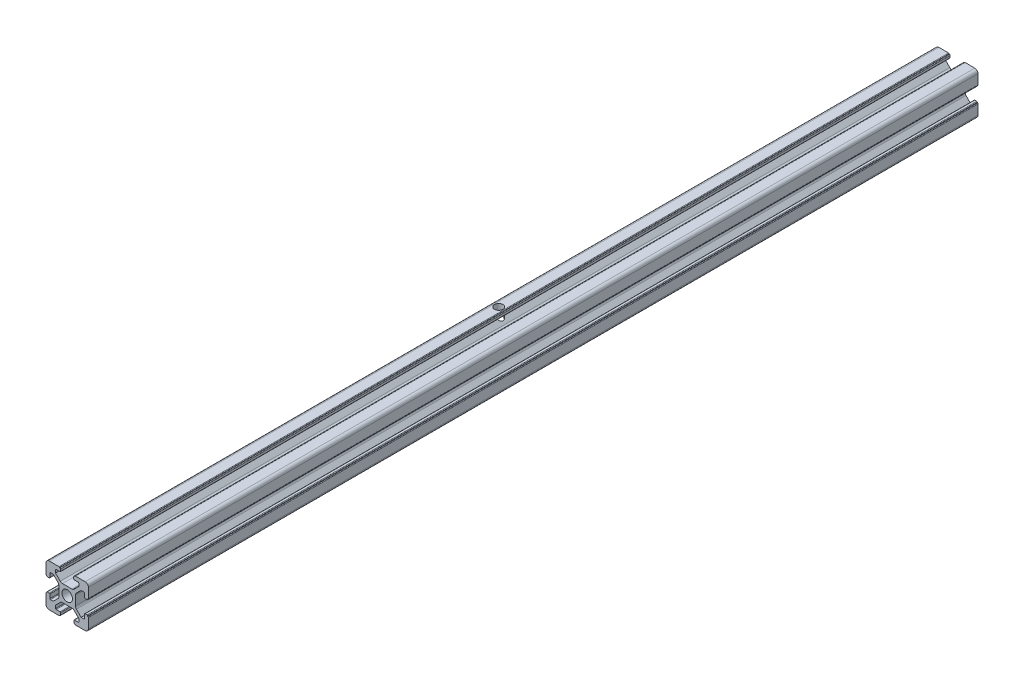
from build123d import *

# Parameters (mm, degrees)
BOSS_EXTRUDE1_DEPTH = 420
F_3DSKETCH2_R       = 2.5
CUT_EXTRUDE1_DEPTH  = 421.238108785
SKETCH2_R           = 2
CUT_EXTRUDE2_DEPTH  = 421.594909523


with BuildPart() as part:
    # Sketch1 → Boss-Extrude1 (new body)
    with BuildSketch(Plane.XY):
        with BuildLine():
            ThreePointArc((-4.339541497, 3.27832502), (-4.01438237, 2.791689997), (-3.900201668, 2.217664848))
            Line((-3.900201668, 2.217664848), (-3.900201668, -2.220777458))
            ThreePointArc((-3.900201668, -2.220777458), (-4.013982246, -2.793835668), (-4.338062619, -3.279956687))
            ThreePointArc((-4.338062619, -3.279956687), (-4.338801799, -3.280697416), (-4.339541497, -3.28143763))
            Line((-4.339541497, -3.28143763), (-6.559305445, -5.501201578))
            Line((-6.559305445, -5.501201578), (-7.918645273, -5.501201578))
            ThreePointArc((-7.918645273, -5.501201578), (-8.116635172, -5.419191476), (-8.198645273, -5.221201578))
            Line((-8.198645273, -5.221201578), (-8.198645273, -3.381201578))
            ThreePointArc((-8.198645273, -3.381201578), (-8.280655374, -3.183211679), (-8.478645273, -3.101201578))
            Line((-8.478645273, -3.101201578), (-9.418645273, -3.101201578))
            ThreePointArc((-9.418645273, -3.101201578), (-9.616635172, -3.183211679), (-9.698645273, -3.381201578))
            Line((-9.698645273, -3.381201578), (-9.698645273, -3.601201578))
            Line((-9.698645273, -3.601201578), (-9.718645273, -3.601201578))
            ThreePointArc((-9.718645273, -3.601201578), (-9.916635172, -3.683211679), (-9.998645273, -3.881201578))
            Line((-9.998645273, -3.881201578), (-9.998645273, -8.501201578))
            ThreePointArc((-9.998645273, -8.501201578), (-9.559305445, -9.561861749), (-8.498645273, -10.001201578))
            Line((-8.498645273, -10.001201578), (-3.878645273, -10.001201578))
            ThreePointArc((-3.878645273, -10.001201578), (-3.680655374, -9.919191476), (-3.598645273, -9.721201578))
            Line((-3.598645273, -9.721201578), (-3.598645273, -9.701201578))
            Line((-3.598645273, -9.701201578), (-3.378645273, -9.701201578))
            ThreePointArc((-3.378645273, -9.701201578), (-3.180655374, -9.619191476), (-3.098645273, -9.421201578))
            Line((-3.098645273, -9.421201578), (-3.098645273, -8.481201578))
            ThreePointArc((-3.098645273, -8.481201578), (-3.180655374, -8.283211679), (-3.378645273, -8.201201578))
            Line((-3.378645273, -8.201201578), (-5.218645273, -8.201201578))
            ThreePointArc((-5.218645273, -8.201201578), (-5.416635172, -8.119191476), (-5.498645273, -7.921201578))
            Line((-5.498645273, -7.921201578), (-5.498645273, -6.561861749))
            Line((-5.498645273, -6.561861749), (-3.277324929, -4.340541406))
            ThreePointArc((-3.277324929, -4.340541406), (-2.790689906, -4.015382279), (-2.216664757, -3.901201578))
            Line((-2.216664757, -3.901201578), (2.234977304, -3.899793498))
            ThreePointArc((2.234977304, -3.899793498), (2.801097117, -4.016727825), (3.280957809, -4.339061494))
            Line((3.280957809, -4.339061494), (5.502201668, -6.560305354))
            Line((5.502201668, -6.560305354), (5.502201668, -7.919645182))
            ThreePointArc((5.502201668, -7.919645182), (5.420191567, -8.117635081), (5.222201668, -8.199645182))
            Line((5.222201668, -8.199645182), (3.382201668, -8.199645182))
            ThreePointArc((3.382201668, -8.199645182), (3.18421177, -8.281655283), (3.102201668, -8.479645182))
            Line((3.102201668, -8.479645182), (3.102201668, -9.419645182))
            ThreePointArc((3.102201668, -9.419645182), (3.18421177, -9.617635081), (3.382201668, -9.699645182))
            Line((3.382201668, -9.699645182), (3.602201668, -9.699645182))
            Line((3.602201668, -9.699645182), (3.602201668, -9.719645182))
            ThreePointArc((3.602201668, -9.719645182), (3.68421177, -9.917635081), (3.882201668, -9.999645182))
            Line((3.882201668, -9.999645182), (8.502201668, -9.999645182))
            ThreePointArc((8.502201668, -9.999645182), (9.56286184, -9.560305354), (10.002201668, -8.499645182))
            Line((10.002201668, -8.499645182), (10.002201668, -3.879645182))
            ThreePointArc((10.002201668, -3.879645182), (9.920191567, -3.681655283), (9.722201668, -3.599645182))
            Line((9.722201668, -3.599645182), (9.702201668, -3.599645182))
            Line((9.702201668, -3.599645182), (9.702201668, -3.379645182))
            ThreePointArc((9.702201668, -3.379645182), (9.620191567, -3.181655283), (9.422201668, -3.099645182))
            Line((9.422201668, -3.099645182), (8.482201668, -3.099645182))
            ThreePointArc((8.482201668, -3.099645182), (8.28421177, -3.181655283), (8.202201668, -3.379645182))
            Line((8.202201668, -3.379645182), (8.202201668, -5.219645182))
            ThreePointArc((8.202201668, -5.219645182), (8.120191567, -5.417635081), (7.922201668, -5.499645182))
            Line((7.922201668, -5.499645182), (6.56286184, -5.499645182))
            Line((6.56286184, -5.499645182), (4.341541497, -3.278324838))
            ThreePointArc((4.341541497, -3.278324838), (4.01638237, -2.791689815), (3.902201668, -2.217664667))
            Line((3.902201668, -2.217664667), (3.900793589, 2.233977395))
            ThreePointArc((3.900793589, 2.233977395), (4.017727916, 2.800097207), (4.340061585, 3.2799579))
            Line((4.340061585, 3.2799579), (6.561305445, 5.501201759))
            Line((6.561305445, 5.501201759), (7.920645273, 5.501201759))
            ThreePointArc((7.920645273, 5.501201759), (8.118635172, 5.419191658), (8.200645273, 5.221201759))
            Line((8.200645273, 5.221201759), (8.200645273, 3.381201759))
            ThreePointArc((8.200645273, 3.381201759), (8.282655374, 3.183211861), (8.480645273, 3.101201759))
            Line((8.480645273, 3.101201759), (9.420645273, 3.101201759))
            ThreePointArc((9.420645273, 3.101201759), (9.618635172, 3.183211861), (9.700645273, 3.381201759))
            Line((9.700645273, 3.381201759), (9.700645273, 3.601201759))
            Line((9.700645273, 3.601201759), (9.720645273, 3.601201759))
            ThreePointArc((9.720645273, 3.601201759), (9.918635172, 3.683211861), (10.000645273, 3.881201759))
            Line((10.000645273, 3.881201759), (10.000645273, 8.501201759))
            ThreePointArc((10.000645273, 8.501201759), (9.561305445, 9.561861931), (8.500645273, 10.001201759))
            Line((8.500645273, 10.001201759), (3.880645273, 10.001201759))
            ThreePointArc((3.880645273, 10.001201759), (3.682655374, 9.919191658), (3.600645273, 9.721201759))
            Line((3.600645273, 9.721201759), (3.600645273, 9.701201759))
            Line((3.600645273, 9.701201759), (3.380645273, 9.701201759))
            ThreePointArc((3.380645273, 9.701201759), (3.182655374, 9.619191658), (3.100645273, 9.421201759))
            Line((3.100645273, 9.421201759), (3.100645273, 8.481201759))
            ThreePointArc((3.100645273, 8.481201759), (3.182655374, 8.283211861), (3.380645273, 8.201201759))
            Line((3.380645273, 8.201201759), (5.220645273, 8.201201759))
            ThreePointArc((5.220645273, 8.201201759), (5.418635172, 8.119191658), (5.500645273, 7.921201759))
            Line((5.500645273, 7.921201759), (5.500645273, 6.561861931))
            Line((5.500645273, 6.561861931), (3.279324929, 4.340541588))
            ThreePointArc((3.279324929, 4.340541588), (2.792689906, 4.015382461), (2.218664757, 3.901201759))
            Line((2.218664757, 3.901201759), (-2.232977304, 3.89979368))
            ThreePointArc((-2.232977304, 3.89979368), (-2.799097117, 4.016728006), (-3.278957809, 4.339061676))
            Line((-3.278957809, 4.339061676), (-5.500201668, 6.560305535))
            Line((-5.500201668, 6.560305535), (-5.500201668, 7.919645364))
            ThreePointArc((-5.500201668, 7.919645364), (-5.418191567, 8.117635262), (-5.220201668, 8.199645364))
            Line((-5.220201668, 8.199645364), (-3.380201668, 8.199645364))
            ThreePointArc((-3.380201668, 8.199645364), (-3.18221177, 8.281655465), (-3.100201668, 8.479645364))
            Line((-3.100201668, 8.479645364), (-3.100201668, 9.419645364))
            ThreePointArc((-3.100201668, 9.419645364), (-3.18221177, 9.617635262), (-3.380201668, 9.699645364))
            Line((-3.380201668, 9.699645364), (-3.600201668, 9.699645364))
            Line((-3.600201668, 9.699645364), (-3.600201668, 9.719645364))
            ThreePointArc((-3.600201668, 9.719645364), (-3.68221177, 9.917635262), (-3.880201668, 9.999645364))
            Line((-3.880201668, 9.999645364), (-8.500201668, 9.999645364))
            ThreePointArc((-8.500201668, 9.999645364), (-9.56086184, 9.560305535), (-10.000201668, 8.499645364))
            Line((-10.000201668, 8.499645364), (-10.000201668, 3.879645364))
            ThreePointArc((-10.000201668, 3.879645364), (-9.918191567, 3.681655465), (-9.720201668, 3.599645364))
            Line((-9.720201668, 3.599645364), (-9.700201668, 3.599645364))
            Line((-9.700201668, 3.599645364), (-9.700201668, 3.379645364))
            ThreePointArc((-9.700201668, 3.379645364), (-9.618191567, 3.181655465), (-9.420201668, 3.099645364))
            Line((-9.420201668, 3.099645364), (-8.480201668, 3.099645364))
            ThreePointArc((-8.480201668, 3.099645364), (-8.28221177, 3.181655465), (-8.200201668, 3.379645364))
            Line((-8.200201668, 3.379645364), (-8.200201668, 5.219645364))
            ThreePointArc((-8.200201668, 5.219645364), (-8.118191567, 5.417635262), (-7.920201668, 5.499645364))
            Line((-7.920201668, 5.499645364), (-6.56086184, 5.499645364))
            Line((-6.56086184, 5.499645364), (-4.339541497, 3.27832502))
        make_face()
    extrude(amount=BOSS_EXTRUDE1_DEPTH)

    # 3DSketch2 → Cut-Extrude1 (cut, through all)
    with BuildSketch(Plane.XY):
        Circle(F_3DSKETCH2_R)
    extrude(amount=CUT_EXTRUDE1_DEPTH, mode=Mode.SUBTRACT)

    # Sketch2 → Cut-Extrude2 (cut, through all)
    with BuildSketch(Plane(origin=(0, 9.999645364, 0), x_dir=(1, 0, 0), z_dir=(0, 1, 0))):
        with Locations((-6.25, -210)):
            Circle(SKETCH2_R)
    extrude(amount=-CUT_EXTRUDE2_DEPTH, mode=Mode.SUBTRACT)


solid = part.part
